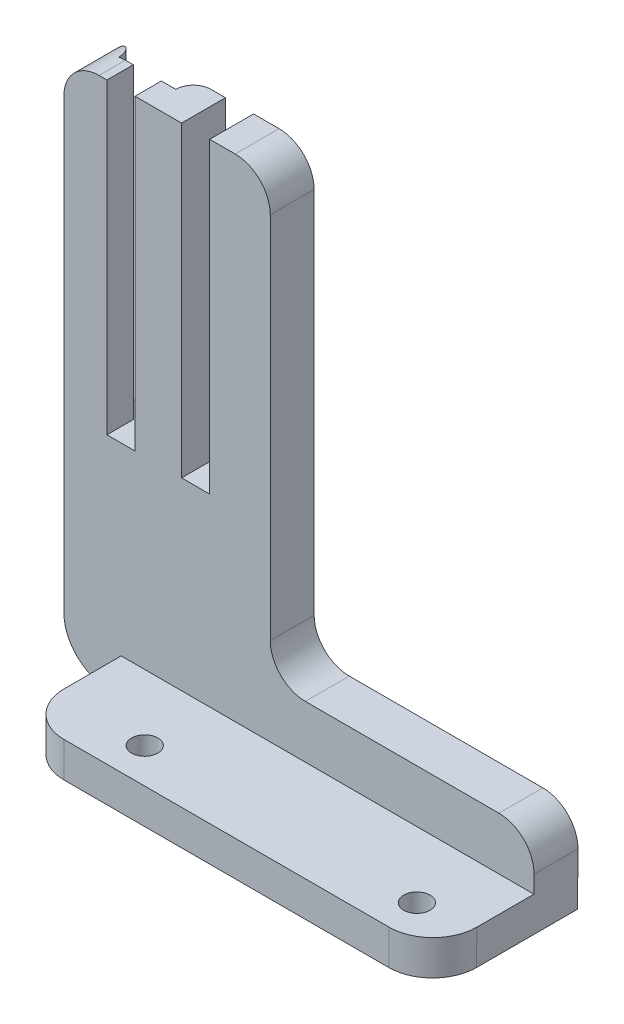
from build123d import *

# Parameters (mm, degrees)
EXTRUDE1_DEPTH = 5
EXTRUDE2_DEPTH = 11.5
SKETCH5_R      = 1.5
EXTRUDE3_DEPTH = 4
FILLET2_R      = 5
FILLET3_R      = 4
FILLET4_R      = 5
SKETCH4_W      = 6.5
SKETCH4_H      = 4
EXTRUDE4_DEPTH = 35
FILLET1_R      = 2


with BuildPart() as part:
    # Sketch1 → Extrude1 (new body)
    with BuildSketch(Plane.XY):
        Polygon((24.583407752, -25), (24.660567061, -15), (-5.416666667, -15), (-5.416666667, 35), (-12.316666667, 35), (-12.316666667, 0), (-15.516666667, 0), (-15.516666667, 35), (-20.816666667, 35), (-20.816666667, 0), (-24.016666667, 0), (-24.016666667, 35), (-28.916666667, 35), (-28.916666667, -25), align=None)
    extrude(amount=EXTRUDE1_DEPTH)

    # Sketch3 → Extrude2 (add)
    with BuildSketch(Plane.XY.offset(5)):
        Polygon((-22.394876452, -21), (24.614271475, -21), (24.583407752, -25), (-22.394876452, -25), align=None)
    extrude(amount=EXTRUDE2_DEPTH)

    # Sketch5 → Extrude3 (cut)
    with BuildSketch(Plane(origin=(0, -21, 0), x_dir=(1, 0, 0), z_dir=(0, 1, 0))):
        with Locations(Location((-12.214752954, -12.501481725, 0), (0, 0, 270))):
            Circle(SKETCH5_R)
        with Locations(Location((18.785247046, -12.501481725, 0), (0, 0, 270))):
            Circle(SKETCH5_R)
    extrude(amount=-EXTRUDE3_DEPTH, mode=Mode.SUBTRACT)

    # Fillet2
    fillet2_edges = [part.edges().sort_by_distance(p)[0] for p in [
        (-22.394876452, -23, 16.5),
        (24.598839614, -23, 16.5),
    ]]
    fillet(fillet2_edges, radius=FILLET2_R)

    # Fillet3
    fillet3_edges = [part.edges().sort_by_distance(p)[0] for p in [
        (-5.416666667, 35, 2.5),
        (-5.416666667, -15, 2.5),
        (24.660567061, -15, 2.5),
        (-28.916666667, 35, 2.5),
    ]]
    fillet(fillet3_edges, radius=FILLET3_R)

    # Fillet4
    fillet4_edges = [part.edges().sort_by_distance(p)[0] for p in [
        (-28.916666667, -25, 2.5),
    ]]
    fillet(fillet4_edges, radius=FILLET4_R)

    # Sketch4 → Extrude4 (cut)
    with BuildSketch(Plane(origin=(0, 35, 0), x_dir=(1, 0, 0), z_dir=(0, 1, 0))):
        with Locations((-22.416666667, 0)):
            Rectangle(SKETCH4_W, SKETCH4_H)
    extrude(amount=-EXTRUDE4_DEPTH, mode=Mode.SUBTRACT)

    # Fillet1
    fillet1_edges = [part.edges().sort_by_distance(p)[0] for p in [
        (-19.166666667, 17.5, 0),
        (-25.666666667, 17.464529206, 0),
    ]]
    fillet(fillet1_edges, radius=FILLET1_R - 0.0001)  # a hair under: the kernel refuses the full size


solid = part.part
